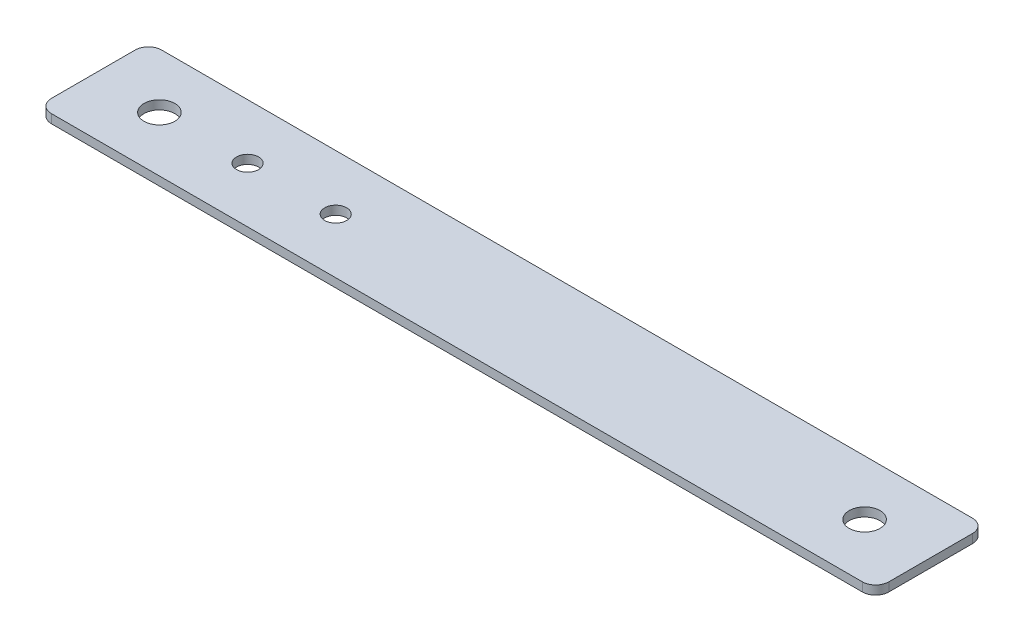
from build123d import *

# Parameters (mm, degrees)
BASE_FLANGE1_DEPTH    = 2
F_5_0MM_DOWEL_HOLE1_D = 7
F_5_0MM_DOWEL_HOLE2_D = 5


# Sheet-metal steps are written as plain solids
with BuildPart() as part:
    # Sketch1 → Base-Flange1 (new body)
    with BuildSketch(Plane(origin=(0, 0, 0), x_dir=(1, 0, 0), z_dir=(0, 1, 0))):
        with BuildLine():
            Line((92, -12.5), (-92, -12.5))
            ThreePointArc((-92, -12.5), (-94.121320344, -11.621320344), (-95, -9.5))
            Line((-95, -9.5), (-95, 9.5))
            ThreePointArc((-95, 9.5), (-94.121320344, 11.621320344), (-92, 12.5))
            Line((-92, 12.5), (92, 12.5))
            ThreePointArc((92, 12.5), (94.121320344, 11.621320344), (95, 9.5))
            Line((95, 9.5), (95, -9.5))
            ThreePointArc((95, -9.5), (94.121320344, -11.621320344), (92, -12.5))
        make_face()
    extrude(amount=BASE_FLANGE1_DEPTH)

    # Ø5.0mm Dowel Hole1 (through all)
    with Locations(Plane(origin=(0, 2, 0), x_dir=(1, 0, 0), z_dir=(0, 1, 0))):
        with Locations((-80, 0), (80, 0)):
            Hole(F_5_0MM_DOWEL_HOLE1_D / 2)

    # Ø5.0mm Dowel Hole2 (through all)
    with Locations(Plane(origin=(0, 2, 0), x_dir=(1, 0, 0), z_dir=(0, 1, 0))):
        with Locations((-60, 0), (-40, 0)):
            Hole(F_5_0MM_DOWEL_HOLE2_D / 2)


solid = part.part
